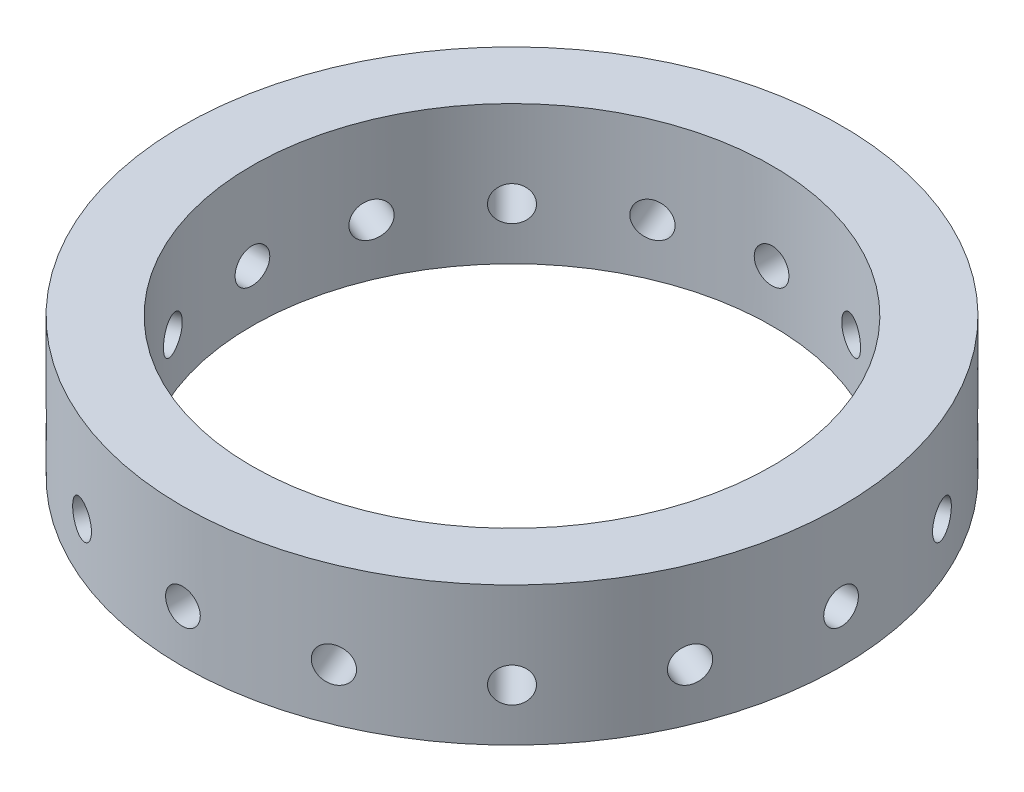
from build123d import *

# Parameters (mm, degrees)
SKETCH1_R                   = 60.325
SKETCH1_R_2                 = 47.625
BOSS_EXTRUDE1_DEPTH         = 25.4
F_1_4_0_25_DIAMETER_HOLE1_D = 6.35
CIRPATTERN1_COUNT           = 16


with BuildPart() as part:
    # Sketch1 → Boss-Extrude1 (new body)
    with BuildSketch(Plane(origin=(0, 0, 0), x_dir=(1, 0, 0), z_dir=(0, 1, 0))):
        Circle(SKETCH1_R)
        Circle(SKETCH1_R_2, mode=Mode.SUBTRACT)
    extrude(amount=BOSS_EXTRUDE1_DEPTH)

    # 1/4 (0.25) Diameter Hole1 (through all)
    with Locations(Plane(origin=(0, 0, -60.325), x_dir=(-1, 0, 0), z_dir=(0, 0, -1))):
        with Locations((0, 9.525)):
            f_1_4_0_25_diameter_hole1 = Hole(F_1_4_0_25_DIAMETER_HOLE1_D / 2)

    # CirPattern1: 1/4 (0.25) Diameter Hole1 ×16 about axis
    cirpattern1_axis = Axis((0, 0, 0), (0, 1, 0))
    for i in range(1, CIRPATTERN1_COUNT):
        add(f_1_4_0_25_diameter_hole1.rotate(cirpattern1_axis, i * 360 / CIRPATTERN1_COUNT), mode=Mode.SUBTRACT)


solid = part.part
